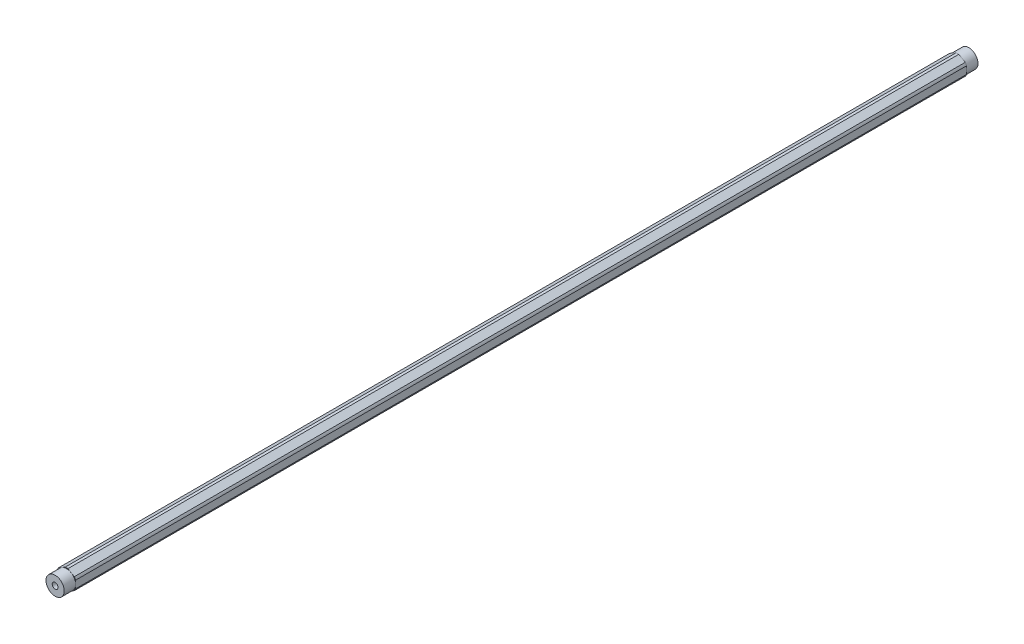
from build123d import *

# Parameters (mm, degrees)
SKETCH2_R                            = 2.0193
BOSS_EXTRUDE1_DEPTH                  = 309.5625
SKETCH7_R                            = 6.35
BOSS_EXTRUDE2_DEPTH                  = 7.9375
F_10_32_TAPPED_HOLE2_D               = 4.0386
F_10_32_TAPPED_HOLE2_DEPTH           = 16.34744
F_10_32_TAPPED_HOLE2_TIP             = 1.213317848
F_10_32_TAPPED_HOLE2_ON_FACE_2_D     = 4.0386
F_10_32_TAPPED_HOLE2_ON_FACE_2_DEPTH = 16.34744
F_10_32_TAPPED_HOLE2_ON_FACE_2_TIP   = 1.213317848


with BuildPart() as part:
    # Sketch2 → Boss-Extrude1 (new, symmetric)
    with BuildSketch(Plane.XY):
        with BuildLine():
            ThreePointArc((0.93173274, 6.79441227), (0, 6.858), (-0.93173274, 6.79441227))
            Line((-0.93173274, 6.79441227), (-5.41826726, 4.204110358))
            ThreePointArc((-5.41826726, 4.204110358), (-5.939202219, 3.429), (-6.35, 2.590301913))
            Line((-6.35, 2.590301913), (-6.35, -2.590301913))
            ThreePointArc((-6.35, -2.590301913), (-5.939202219, -3.429), (-5.41826726, -4.204110358))
            Line((-5.41826726, -4.204110358), (-0.93173274, -6.79441227))
            ThreePointArc((-0.93173274, -6.79441227), (0, -6.858), (0.93173274, -6.79441227))
            Line((0.93173274, -6.79441227), (5.41826726, -4.204110358))
            ThreePointArc((5.41826726, -4.204110358), (5.939202219, -3.429), (6.35, -2.590301913))
            Line((6.35, -2.590301913), (6.35, 2.590301913))
            ThreePointArc((6.35, 2.590301913), (5.939202219, 3.429), (5.41826726, 4.204110358))
            Line((5.41826726, 4.204110358), (0.93173274, 6.79441227))
        make_face()
        Circle(SKETCH2_R, mode=Mode.SUBTRACT)
    extrude(amount=BOSS_EXTRUDE1_DEPTH, both=True)

    # Sketch7 → Boss-Extrude2 (add)
    with BuildSketch(Plane.XY.offset(309.5625)):
        Circle(SKETCH7_R)
    boss_extrude2 = extrude(amount=BOSS_EXTRUDE2_DEPTH)

    # Mirror1: Boss-Extrude2 across plane
    add(boss_extrude2.mirror(Plane.XY))

    # #10-32 Tapped Hole2
    with Locations(Plane.XY.offset(317.5)):
        with Locations((0, 0)):
            Hole(F_10_32_TAPPED_HOLE2_D / 2, depth=F_10_32_TAPPED_HOLE2_DEPTH)
            with Locations((0, 0, -(F_10_32_TAPPED_HOLE2_DEPTH + F_10_32_TAPPED_HOLE2_TIP / 2))):  # 118° drill point
                Cone(0, F_10_32_TAPPED_HOLE2_D / 2, F_10_32_TAPPED_HOLE2_TIP, mode=Mode.SUBTRACT)

    # #10-32 Tapped Hole2 on face 2
    with Locations(Plane(origin=(0, 0, -317.5), x_dir=(-1, 0, 0), z_dir=(0, 0, -1))):
        with Locations((0, 0)):
            Hole(F_10_32_TAPPED_HOLE2_ON_FACE_2_D / 2, depth=F_10_32_TAPPED_HOLE2_ON_FACE_2_DEPTH)
            with Locations((0, 0, -(F_10_32_TAPPED_HOLE2_ON_FACE_2_DEPTH + F_10_32_TAPPED_HOLE2_ON_FACE_2_TIP / 2))):  # 118° drill point
                Cone(0, F_10_32_TAPPED_HOLE2_ON_FACE_2_D / 2, F_10_32_TAPPED_HOLE2_ON_FACE_2_TIP, mode=Mode.SUBTRACT)


solid = part.part
